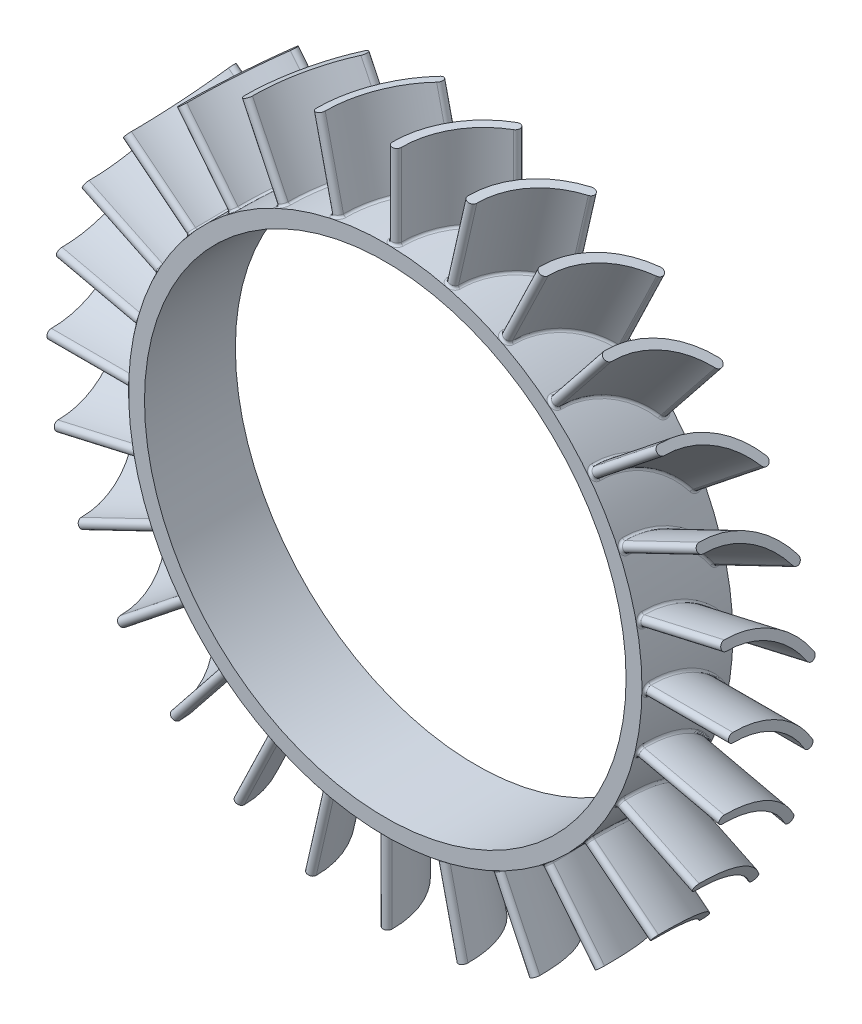
from build123d import *

# Parameters (mm, degrees)
SKETCH1_R                = 56.5
SKETCH1_R_2              = 53
BOSS_EXTRUDE1_DEPTH      = 10
BOSS_EXTRUDE2_START      = 55
BOSS_EXTRUDE2_DEPTH      = 20
FILLET1_R                = 0.5
CIRPATTERN1_COUNT        = 28
FILLET1_OF_CIRPATTERN1_R = 0.5


with BuildPart() as part:
    # Sketch1 → Boss-Extrude1 (new, symmetric)
    with BuildSketch(Plane.XY):
        Circle(SKETCH1_R)
        Circle(SKETCH1_R_2, mode=Mode.SUBTRACT)
    extrude(amount=BOSS_EXTRUDE1_DEPTH, both=True)

    # Sketch2 → Boss-Extrude2 (add)
    with BuildSketch(Plane(origin=(0, 0, 0), x_dir=(1, 0, 0), z_dir=(0, 1, 0)).offset(BOSS_EXTRUDE2_START)):
        with BuildLine():
            ThreePointArc((0, -8.5), (2.634335854, 1.601808083), (10, 9))
            ThreePointArc((10, 9), (11.366008469, 8.633911401), (10.99991987, 7.267902932))
            ThreePointArc((10.99991987, 7.267902932), (4.370822138, 0.609530207), (1.99991987, -8.482097068))
            ThreePointArc((1.99991987, -8.482097068), (1.008911401, -9.491008469), (0, -8.5))
        make_face()
    boss_extrude2 = extrude(amount=BOSS_EXTRUDE2_DEPTH)

    # Fillet1
    fillet1_edges = [part.edges().sort_by_distance(p)[0] for p in [
        (2.644266496, 56.438088688, -1.619166561),
        (2.644266496, 56.438088688, -1.619166561),
        (4.383027613, 56.329735208, -0.630855991),
        (1.009014458, 56.490989457, 9.49100754),
    ]]
    fillet(fillet1_edges, radius=FILLET1_R)

    # CirPattern1: Boss-Extrude2 ×28 about axis
    cirpattern1_axis = Axis((0, 0, 10), (0, 0, -1))
    for i in range(1, CIRPATTERN1_COUNT):
        add(boss_extrude2.rotate(cirpattern1_axis, i * 360 / CIRPATTERN1_COUNT))

    # Fillet1 of CirPattern1
    fillet1_of_cirpattern1_edges = [part.edges().sort_by_distance(p)[0] for p in [
        (15.13662542, 54.434663322, -1.619166561),
        (15.13662542, 54.434663322, -1.619166561),
        (16.807681248, 53.942115742, -0.630855991),
        (13.554144093, 54.850115569, 9.49100754),
        (26.86997074, 49.701656637, -1.619166561),
        (26.86997074, 49.701656637, -1.619166561),
        (28.389527562, 48.84961335, -0.630855991),
        (25.419612346, 50.458827852, 9.49100754),
        (37.255943528, 42.476401353, -1.619166561),
        (37.255943528, 42.476401353, -1.619166561),
        (38.54780442, 41.307587366, -0.630855991),
        (36.010435093, 43.537323809, 9.49100754),
        (45.77374774, 33.121201938, -1.619166561),
        (45.77374774, 33.121201938, -1.619166561),
        (46.773133403, 31.694226467, -0.630855991),
        (44.795544258, 34.432676554, 9.49100754),
        (51.996265106, 22.105167157, -1.619166561),
        (51.996265106, 22.105167157, -1.619166561),
        (52.653062169, 20.491584709, -0.630855991),
        (51.334417784, 23.601431118, 9.49100754),
        (55.611472623, 9.980686991, -1.619166561),
        (55.611472623, 9.980686991, -1.619166561),
        (55.892746538, 8.261409328, -0.630855991),
        (55.299169248, 11.586711375, 9.49100754),
        (56.438088688, -2.644266496, -1.619166561),
        (56.438088688, -2.644266496, -1.619166561),
        (56.329735208, -4.383027613, -0.630855991),
        (56.490989457, -1.009014458, 9.49100754),
        (54.434663322, -15.13662542, -1.619166561),
        (54.434663322, -15.13662542, -1.619166561),
        (53.942115742, -16.807681248, -0.630855991),
        (54.850115569, -13.554144093, 9.49100754),
        (49.701656637, -26.86997074, -1.619166561),
        (49.701656637, -26.86997074, -1.619166561),
        (48.84961335, -28.389527562, -0.630855991),
        (50.458827852, -25.419612346, 9.49100754),
        (42.476401353, -37.255943528, -1.619166561),
        (42.476401353, -37.255943528, -1.619166561),
        (41.307587366, -38.54780442, -0.630855991),
        (43.537323809, -36.010435093, 9.49100754),
        (33.121201938, -45.77374774, -1.619166561),
        (33.121201938, -45.77374774, -1.619166561),
        (31.694226467, -46.773133403, -0.630855991),
        (34.432676554, -44.795544258, 9.49100754),
        (22.105167157, -51.996265106, -1.619166561),
        (22.105167157, -51.996265106, -1.619166561),
        (20.491584709, -52.653062169, -0.630855991),
        (23.601431118, -51.334417784, 9.49100754),
        (9.980686991, -55.611472623, -1.619166561),
        (9.980686991, -55.611472623, -1.619166561),
        (8.261409328, -55.892746538, -0.630855991),
        (11.586711375, -55.299169248, 9.49100754),
        (-2.644266496, -56.438088688, -1.619166561),
        (-2.644266496, -56.438088688, -1.619166561),
        (-4.383027613, -56.329735208, -0.630855991),
        (-1.009014458, -56.490989457, 9.49100754),
        (-15.13662542, -54.434663322, -1.619166561),
        (-15.13662542, -54.434663322, -1.619166561),
        (-16.807681248, -53.942115742, -0.630855991),
        (-13.554144093, -54.850115569, 9.49100754),
        (-26.86997074, -49.701656637, -1.619166561),
        (-26.86997074, -49.701656637, -1.619166561),
        (-28.389527562, -48.84961335, -0.630855991),
        (-25.419612346, -50.458827852, 9.49100754),
        (-37.255943528, -42.476401353, -1.619166561),
        (-37.255943528, -42.476401353, -1.619166561),
        (-38.54780442, -41.307587366, -0.630855991),
        (-36.010435093, -43.537323809, 9.49100754),
        (-45.77374774, -33.121201938, -1.619166561),
        (-45.77374774, -33.121201938, -1.619166561),
        (-46.773133403, -31.694226467, -0.630855991),
        (-44.795544258, -34.432676554, 9.49100754),
        (-51.996265106, -22.105167157, -1.619166561),
        (-51.996265106, -22.105167157, -1.619166561),
        (-52.653062169, -20.491584709, -0.630855991),
        (-51.334417784, -23.601431118, 9.49100754),
        (-55.611472623, -9.980686991, -1.619166561),
        (-55.611472623, -9.980686991, -1.619166561),
        (-55.892746538, -8.261409328, -0.630855991),
        (-55.299169248, -11.586711375, 9.49100754),
        (-56.438088688, 2.644266496, -1.619166561),
        (-56.438088688, 2.644266496, -1.619166561),
        (-56.329735208, 4.383027613, -0.630855991),
        (-56.490989457, 1.009014458, 9.49100754),
        (-54.434663322, 15.13662542, -1.619166561),
        (-54.434663322, 15.13662542, -1.619166561),
        (-53.942115742, 16.807681248, -0.630855991),
        (-54.850115569, 13.554144093, 9.49100754),
        (-49.701656637, 26.86997074, -1.619166561),
        (-49.701656637, 26.86997074, -1.619166561),
        (-48.84961335, 28.389527562, -0.630855991),
        (-50.458827852, 25.419612346, 9.49100754),
        (-42.476401353, 37.255943528, -1.619166561),
        (-42.476401353, 37.255943528, -1.619166561),
        (-41.307587366, 38.54780442, -0.630855991),
        (-43.537323809, 36.010435093, 9.49100754),
        (-33.121201938, 45.77374774, -1.619166561),
        (-33.121201938, 45.77374774, -1.619166561),
        (-31.694226467, 46.773133403, -0.630855991),
        (-34.432676554, 44.795544258, 9.49100754),
        (-22.105167157, 51.996265106, -1.619166561),
        (-22.105167157, 51.996265106, -1.619166561),
        (-20.491584709, 52.653062169, -0.630855991),
        (-23.601431118, 51.334417784, 9.49100754),
        (-9.980686991, 55.611472623, -1.619166561),
        (-9.980686991, 55.611472623, -1.619166561),
        (-8.261409328, 55.892746538, -0.630855991),
        (-11.586711375, 55.299169248, 9.49100754),
    ]]
    fillet(fillet1_of_cirpattern1_edges, radius=FILLET1_OF_CIRPATTERN1_R)


solid = part.part
